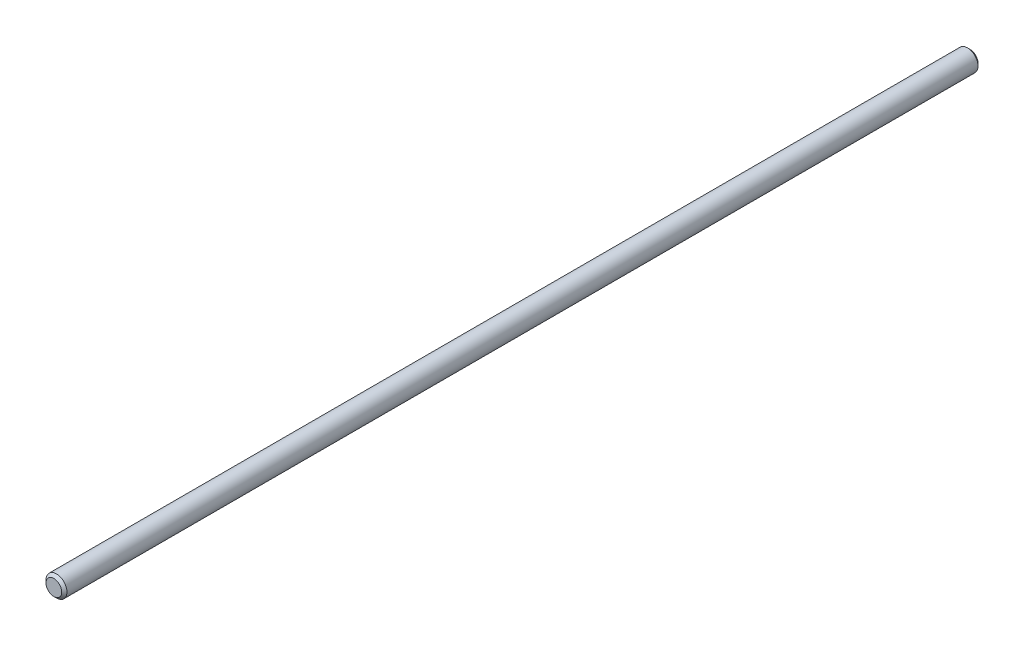
from build123d import *

# Parameters (mm, degrees)
SCHIZZO1_R                   = 4
ESTRUSIONE_ESTRUSIONE1_DEPTH = 350
SMUSSO1_SIZE                 = 1


with BuildPart() as part:
    # Schizzo1 → Estrusione-Estrusione1 (new body)
    with BuildSketch(Plane.XY):
        Circle(SCHIZZO1_R)
    extrude(amount=ESTRUSIONE_ESTRUSIONE1_DEPTH)

    # Smusso1
    smusso1_edges = [part.edges().sort_by_distance(p)[0] for p in [
        (-4, 0, 350),
        (-4, 0, 0),
    ]]
    chamfer(smusso1_edges, length=SMUSSO1_SIZE)


solid = part.part
